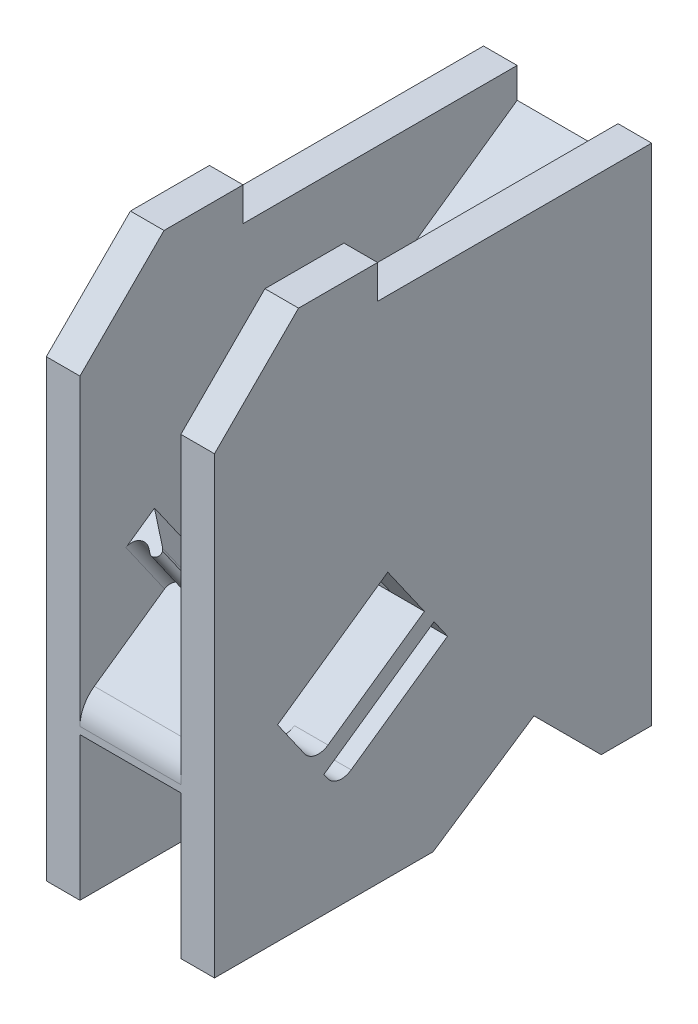
from build123d import *
from build123d.topology import SkipClean

# Parameters (mm, degrees)
SKETCH5_W           = 50
SKETCH5_H           = 130
BOSS_EXTRUDE1_DEPTH = 150
CUT_EXTRUDE1_START  = -25
CUT_EXTRUDE1_DEPTH  = 15
BOSS_EXTRUDE3_START = 30
SKETCH17_W          = 30
SKETCH17_H          = 40
BOSS_EXTRUDE3_DEPTH = 5
SKETCH10_R          = 8.75
CUT_EXTRUDE3_DEPTH  = 100
SKETCH18_W          = 48.5
SKETCH18_H          = 10
BOSS_EXTRUDE4_DEPTH = 10
BOSS_EXTRUDE5_START = 40
SKETCH18_2_W        = 48.5
SKETCH18_2_H        = 10
BOSS_EXTRUDE5_DEPTH = 10
CHAMFER1_SIZE       = 25
CUT_EXTRUDE5_DEPTH  = 70
FILLET1_DEPTH       = 10
FILLET1_START       = 40
FILLET1_2_DEPTH     = 10
CUT_EXTRUDE6_DEPTH  = 70
FILLET2_R           = 10
BOSS_EXTRUDE6_START = 20
BOSS_EXTRUDE6_DEPTH = 20
FILLET4_R           = 3


with BuildPart() as part:
    # Sketch5 → Boss-Extrude1 (new body)
    with BuildSketch(Plane(origin=(0, 0, 0), x_dir=(1, 0, 0), z_dir=(0, 1, 0))):
        with Locations((25, 65)):
            Rectangle(SKETCH5_W, SKETCH5_H)
    extrude(amount=BOSS_EXTRUDE1_DEPTH)

    # Sketch7 → Cut-Extrude1 (cut, symmetric)
    with BuildSketch(Plane(origin=(50, 0, 0), x_dir=(0, 0, -1), z_dir=(1, 0, 0)).offset(CUT_EXTRUDE1_START)):
        Polygon((130, 0), (130, 133.702332435), (0, 42.675352467), (0, 0), align=None)
        Polygon((0, 50), (130, 141.026979967), (130, 150), (0, 150), align=None)
    extrude(amount=CUT_EXTRUDE1_DEPTH, both=True, mode=Mode.SUBTRACT)

    # Sketch17 → Boss-Extrude3 (add)
    with BuildSketch(Plane(origin=(0, 275.412054826, -321.921776796), x_dir=(1, 0, 0), z_dir=(0, -0.819152044288993, -0.5735764363510444)).offset(BOSS_EXTRUDE3_START)):
        with Locations((25, 354.293228142)):
            Rectangle(SKETCH17_W, SKETCH17_H)
    extrude(amount=-BOSS_EXTRUDE3_DEPTH)

    # Sketch10 → Cut-Extrude3 (cut)
    with BuildSketch(Plane(origin=(0, 33.550503583, 23.49231552), x_dir=(1, 0, 0), z_dir=(0, 0.819152044288993, 0.5735764363510444))):
        with Locations(Location((25, 68.178273127, 0), (0, 0, 90))):
            Circle(SKETCH10_R)
    extrude(amount=-CUT_EXTRUDE3_DEPTH, mode=Mode.SUBTRACT)

    # Sketch18 → Boss-Extrude4 (add)
    with BuildSketch(Plane(origin=(0, 0, 0), x_dir=(0, 0, -1), z_dir=(1, 0, 0))):
        with Locations((24.25, 155)):
            Rectangle(SKETCH18_W, SKETCH18_H)
    extrude(amount=BOSS_EXTRUDE4_DEPTH)

    # Sketch18<2> → Boss-Extrude5 (add)
    with BuildSketch(Plane(origin=(0, 0, 0), x_dir=(0, 0, -1), z_dir=(1, 0, 0)).offset(BOSS_EXTRUDE5_START)):
        with Locations((24.25, 155)):
            Rectangle(SKETCH18_2_W, SKETCH18_2_H)
    extrude(amount=BOSS_EXTRUDE5_DEPTH)

    # Chamfer1
    chamfer1_edges = [part.edges().sort_by_distance(p)[0] for p in [
        (5, 160, 0),
        (45, 160, 0),
    ]]
    chamfer(chamfer1_edges, length=CHAMFER1_SIZE)

    # Sketch21 → Cut-Extrude5 (cut)
    with BuildSketch(Plane(origin=(0, 0, 0), x_dir=(0, 0, -1), z_dir=(1, 0, 0))):
        Polygon((62.42420648, 63.190535225), (51.526254189, 78.754424066), (18.760172418, 55.811366612), (29.658124708, 40.247477771), align=None)
        Polygon((69.307123716, 53.360710693), (36.541041945, 30.417653239), (32.52600689, 36.151717549), (65.292088662, 59.094775003), align=None)
    extrude(amount=CUT_EXTRUDE5_DEPTH, mode=Mode.SUBTRACT)

    # Fillet1: read off the stored shape, not the designer's step
    # Fillet1 outline → Fillet1 (add)
    with BuildSketch(Plane.YZ):
        with BuildLine():
            Line((30.417653239, -36.541041945), (33.285535421, -40.636802166))
            ThreePointArc((33.285535421, -40.636802166), (32.457256878, -36.900679096), (34.513413461, -33.673159763))
            Line((34.513413461, -33.673159763), (30.417653239, -36.541041945))
        make_face()
        with BuildLine():
            ThreePointArc((43.115359953, -33.75388493), (42.287081409, -30.01776186), (44.343237992, -26.790242527))
            Line((44.343237992, -26.790242527), (40.247477771, -29.658124708))
            Line((40.247477771, -29.658124708), (43.115359953, -33.75388493))
        make_face()
    extrude(amount=FILLET1_DEPTH)

    # Fillet1 2 outline → Fillet1 2 (add)
    with BuildSketch(Plane.YZ.offset(FILLET1_START)):
        with BuildLine():
            Line((30.417653239, -36.541041945), (33.285535421, -40.636802166))
            ThreePointArc((33.285535421, -40.636802166), (32.457256878, -36.900679096), (34.513413461, -33.673159763))
            Line((34.513413461, -33.673159763), (30.417653239, -36.541041945))
        make_face()
        with BuildLine():
            ThreePointArc((43.115359953, -33.75388493), (42.287081409, -30.01776186), (44.343237992, -26.790242527))
            Line((44.343237992, -26.790242527), (40.247477771, -29.658124708))
            Line((40.247477771, -29.658124708), (43.115359953, -33.75388493))
        make_face()
    extrude(amount=FILLET1_2_DEPTH)

    # Sketch22 → Cut-Extrude6 (cut)
    with BuildSketch(Plane.ZY):
        Polygon((-115, 0), (-95, 20), (-65, 0), align=None)
    extrude(amount=-CUT_EXTRUDE6_DEPTH, mode=Mode.SUBTRACT)

    # Fillet2
    fillet2_edges = [part.edges().sort_by_distance(p)[0] for p in [
        (25, 50, 0),
    ]]
    fillet(fillet2_edges, radius=FILLET2_R)

    # Sketch23 → Boss-Extrude6 (add)
    with SkipClean():  # the faces are left unmerged after this step: merging them gives an invalid solid
        with BuildSketch(Plane(origin=(0, 33.550503583, 23.49231552), x_dir=(1, 0, 0), z_dir=(0, 0.819152044288993, 0.5735764363510445)).offset(BOSS_EXTRUDE6_START)):
            with BuildLine():
                Line((40, 69.739442097), (32.180703308, 63.178273127))
                ThreePointArc((32.180703308, 63.178273127), (31.983337112, 62.906129088), (31.77566264, 62.64176739))
                ThreePointArc((31.77566264, 62.64176739), (32.241088602, 60.832062958), (34.109066137, 60.880139798))
                Line((34.109066137, 60.880139798), (40, 65.823220229))
                Line((40, 65.823220229), (40, 69.739442097))
            make_face()
            with BuildLine():
                ThreePointArc((18.22433736, 62.64176739), (18.016662888, 62.906129088), (17.819296692, 63.178273127))
                Line((17.819296692, 63.178273127), (10, 69.739442097))
                Line((10, 69.739442097), (10, 65.823220229))
                Line((10, 65.823220229), (15.890933863, 60.880139798))
                ThreePointArc((15.890933863, 60.880139798), (17.758911398, 60.832062958), (18.22433736, 62.64176739))
            make_face()
        extrude(amount=-BOSS_EXTRUDE6_DEPTH)

    # Fillet4
    fillet4_edges = [part.edges().sort_by_distance(p)[0] for p in [
        (40, 79.496672114, -24.691145529),
        (10, 79.496672114, -24.691145529),
    ]]
    fillet(fillet4_edges, radius=FILLET4_R)


solid = part.part
